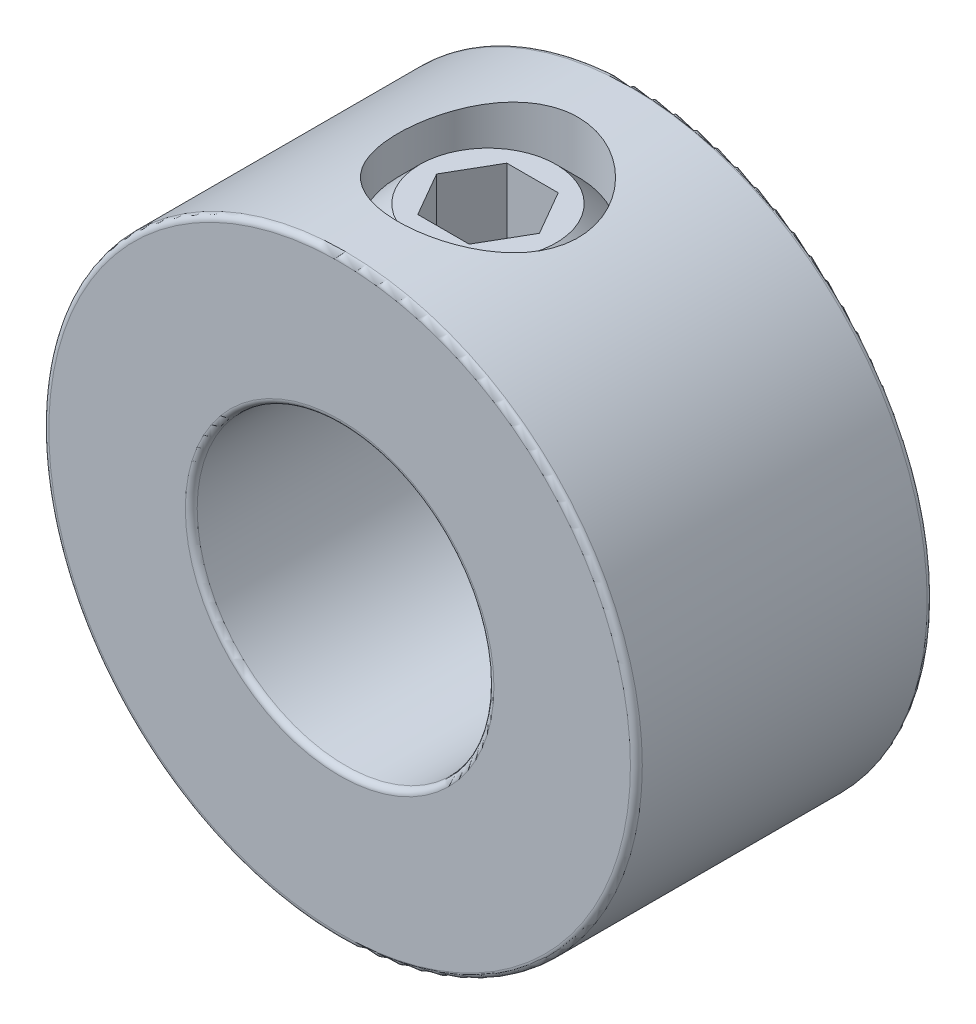
from build123d import *

# Parameters (mm, degrees)
SKETCH1_R          = 7.9375
SKETCH1_R_2        = 3.96875
EXTRUDE1_DEPTH     = 3.96875
SKETCH2_R          = 2.413
CUT_EXTRUDE1_DEPTH = 51.00625
FILLET1_R          = 0.15875
CUT_EXTRUDE2_DEPTH = 2.38125


with BuildPart() as part:
    # Sketch1 → Extrude1 (new, symmetric)
    with BuildSketch(Plane.XY):
        Circle(SKETCH1_R)
        Circle(SKETCH1_R_2, mode=Mode.SUBTRACT)
    extrude(amount=EXTRUDE1_DEPTH, both=True)

    # Sketch2 → Cut-Extrude1 (cut, through all)
    with BuildSketch(Plane(origin=(41.275, 0, 0), x_dir=(0, 0, -1), z_dir=(0, -1, 0))):
        with Locations((0, -41.275)):
            Circle(SKETCH2_R)
    extrude(amount=-CUT_EXTRUDE1_DEPTH, mode=Mode.SUBTRACT)

    # Fillet1
    fillet1_edges = [part.edges().sort_by_distance(p)[0] for p in [
        (-3.96875, 0, -3.96875),
        (-3.96875, 0, 3.96875),
        (-7.9375, 0, -3.96875),
        (-7.9375, 0, 3.96875),
    ]]
    fillet(fillet1_edges, radius=FILLET1_R)


with BuildPart() as body_2:
    # Sketch3 → Revolve1 (revolve)
    with BuildSketch(Plane.XY):
        Polygon((-1.819751616, 3.96875), (-0.71189806, 3.96875), (0, 4.68064806), (0, 7.14375), (-1.819751616, 7.14375), (-2.413, 6.550501616), (-2.413, 4.561998384), align=None)
    revolve(axis=Axis((0, 3.96875, 0), (0, -1, 0)))

    # Sketch4 → Cut-Extrude2 (cut)
    with BuildSketch(Plane(origin=(3.3734375, 7.14375, 0), x_dir=(0, 0, -1), z_dir=(0, -1, 0))):
        Polygon((0, -1.998622171), (-1.190625, -2.686029836), (-1.190625, -4.060845164), (0, -4.748252829), (1.190625, -4.060845164), (1.190625, -2.686029836), align=None)
    extrude(amount=CUT_EXTRUDE2_DEPTH, mode=Mode.SUBTRACT)


solid = Compound([part.part, body_2.part])
